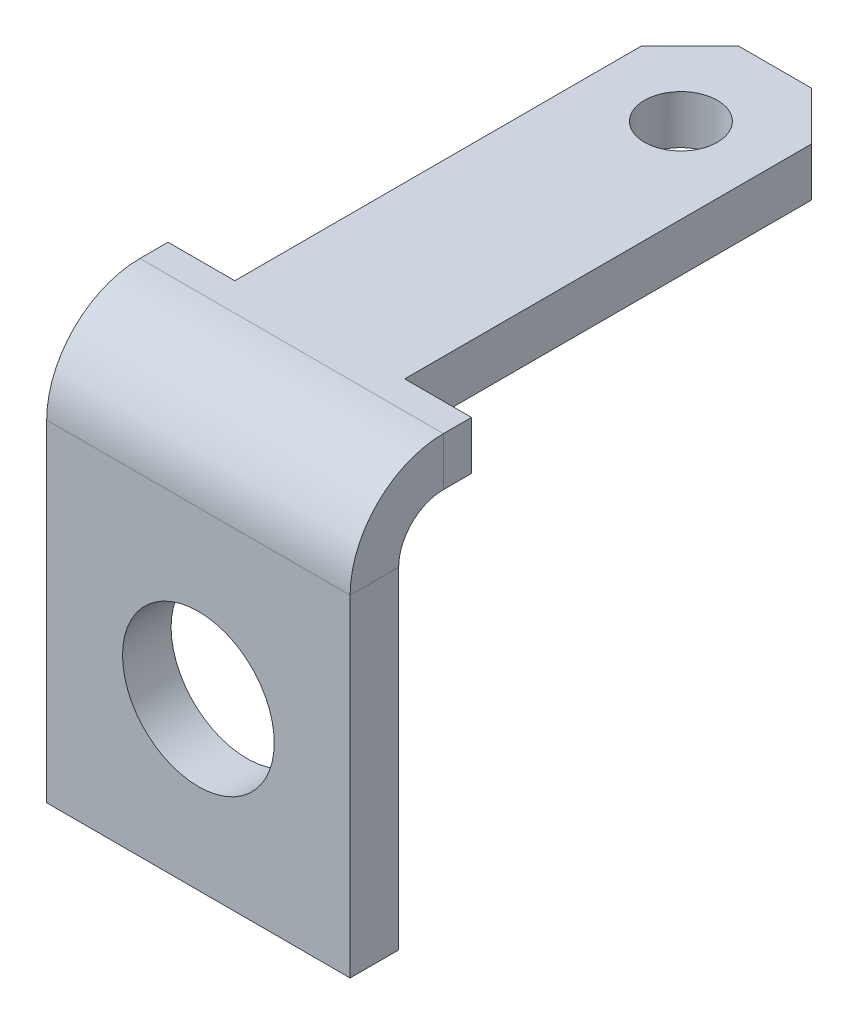
from build123d import *

# Parameters (mm, degrees)
SKETCH_1_W                       = 5
SKETCH_1_H                       = 7
SM_BASE_FLANGE_1_DEPTH           = 0.8
SM_EDGE_FLANGE_1_STRIP_W         = 4.6732
SM_EDGE_FLANGE_1_STRIP_H         = 0.8
SM_EDGE_FLANGE_1_STRIP_CUT_DEPTH = 5
SM_EDGE_FLANGE_1_DEPTH           = 5
SKETCH_7_R                       = 1.25
CUT_EXTRUDE_1_DEPTH              = 10
SKETCH_8_W                       = 1.1
SKETCH_8_H                       = 7.5
CUT_EXTRUDE_2_DEPTH              = 10
SKETCH_9_R                       = 0.6
CUT_EXTRUDE_3_DEPTH              = 10
CHAMFER_1_SIZE                   = 0.8


# Sheet-metal steps are written as plain solids
with BuildPart() as part:
    # Sketch 1 → 基体-法兰1 (new body)
    with BuildSketch(Plane.XY):
        Rectangle(SKETCH_1_W, SKETCH_1_H)
    extrude(amount=-SM_BASE_FLANGE_1_DEPTH)

    # 边线-法兰1 strip (across the edge) → 边线-法兰1 strip cut (cut)
    with BuildSketch(Plane(origin=(-2.5, 3.5, -0.8), x_dir=(0, -1, 0), z_dir=(1, 0, 0))):
        with Locations((-0.8, -0.4)):
            Rectangle(SM_EDGE_FLANGE_1_STRIP_W, SM_EDGE_FLANGE_1_STRIP_H)
    extrude(amount=SM_EDGE_FLANGE_1_STRIP_CUT_DEPTH, mode=Mode.SUBTRACT)

    # 边线-法兰1 section (across the edge) → 边线-法兰1 (add)
    with BuildSketch(Plane(origin=(-2.5, 3.5, -0.8), x_dir=(0, -1, 0), z_dir=(1, 0, 0))):
        with BuildLine():
            Line((0, 0.7366), (0, 8.7))
            Line((0, 8.7), (0.8, 8.7))
            Line((0.8, 8.7), (0.8, 0.7366))
            ThreePointArc((0.8, 0.7366), (1.015745145, 0.215745145), (1.5366, 0))
            Line((1.5366, 0), (1.5366, -0.8))
            ThreePointArc((1.5366, -0.8), (0.45005972, -0.34994028), (0, 0.7366))
        make_face()
    extrude(amount=SM_EDGE_FLANGE_1_DEPTH)

    # 草图7 → 切除-拉伸1 (cut)
    with BuildSketch(Plane(origin=(0, 0, -0.8), x_dir=(-1, 0, 0), z_dir=(0, 0, -1))):
        with Locations((0, -0.7683)):
            Circle(SKETCH_7_R)
    extrude(amount=-CUT_EXTRUDE_1_DEPTH, mode=Mode.SUBTRACT)

    # 草图8 → 切除-拉伸2 (cut)
    with BuildSketch(Plane(origin=(0, 3.5, 0), x_dir=(1, 0, 0), z_dir=(0, 1, 0))):
        with Locations((1.95, 5.75)):
            Rectangle(SKETCH_8_W, SKETCH_8_H)
        with Locations((-1.95, 5.75)):
            Rectangle(SKETCH_8_W, SKETCH_8_H)
    extrude(amount=-CUT_EXTRUDE_2_DEPTH, mode=Mode.SUBTRACT)

    # 草图9 → 切除-拉伸3 (cut)
    with BuildSketch(Plane(origin=(0, 3.5, 0), x_dir=(1, 0, 0), z_dir=(0, 1, 0))):
        with Locations(Location((0, 7.951292253, 0), (0, 0, 270))):
            Circle(SKETCH_9_R)
    extrude(amount=-CUT_EXTRUDE_3_DEPTH, mode=Mode.SUBTRACT)

    # 倒角1
    chamfer_1_edges = [part.edges().sort_by_distance(p)[0] for p in [
        (-1.4, 3.1, -9.5),
        (1.4, 3.1, -9.5),
    ]]
    chamfer(chamfer_1_edges, length=CHAMFER_1_SIZE)


solid = part.part
